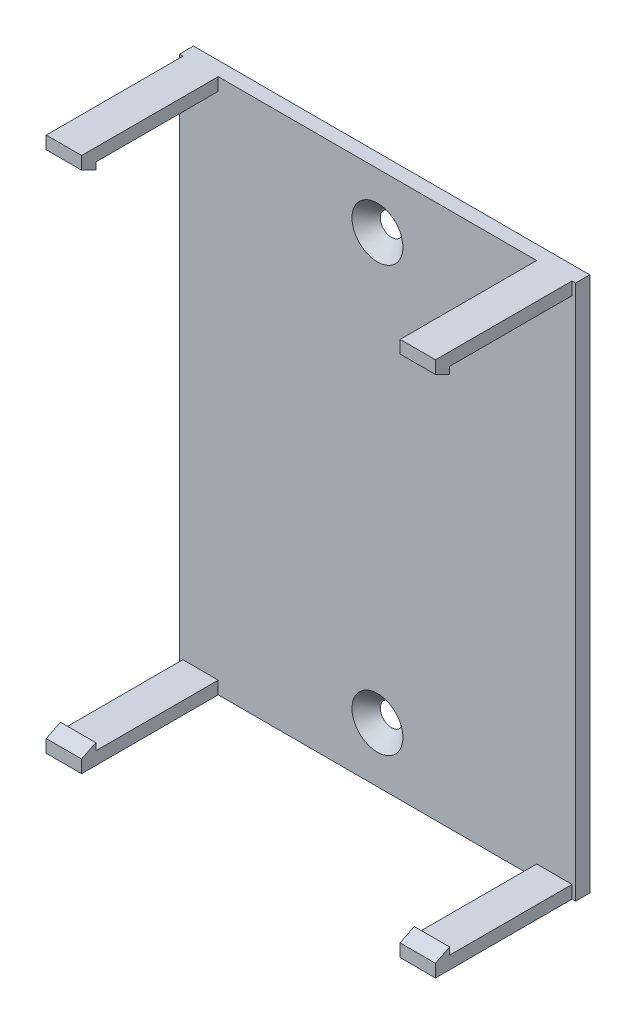
from build123d import *

# Parameters (mm, degrees)
SKETCH_1_W          = 56
SKETCH_1_H          = 75.65
EXTRUDE_1_DEPTH     = 2
SKETCH_2_W          = 5
SKETCH_2_H          = 1.8
EXTRUDE_2_DEPTH     = 19.3
EXTRUDE_3_DEPTH     = 5
EXTRUDE_4_DEPTH     = 5
EXTRUDE_5_DEPTH     = 5
EXTRUDE_6_DEPTH     = 5
SKETCH_7_R          = 1.6
CUT_EXTRUDE_1_DEPTH = 51.864728693
CHAMFER_1_SIZE      = 2


with BuildPart() as part:
    # 草图1 → 凸台-拉伸1 (new body)
    with BuildSketch(Plane.XY):
        Rectangle(SKETCH_1_W, SKETCH_1_H)
    extrude(amount=EXTRUDE_1_DEPTH)

    # 草图2 → 凸台-拉伸2 (add)
    with BuildSketch(Plane.XY.offset(2)):
        with Locations((-25, 36.925)):
            Rectangle(SKETCH_2_W, SKETCH_2_H)
        with Locations((25, 36.925)):
            Rectangle(SKETCH_2_W, SKETCH_2_H)
        with Locations((-25, -36.925)):
            Rectangle(SKETCH_2_W, SKETCH_2_H)
        with Locations((25, -36.925)):
            Rectangle(SKETCH_2_W, SKETCH_2_H)
    extrude(amount=EXTRUDE_2_DEPTH)

    # 草图3 → 凸台-拉伸3 (add)
    with BuildSketch(Plane.ZY.offset(27.5)):
        Polygon((21.3, 36.025), (19.3, 35.025), (19.3, 36.025), align=None)
    extrude(amount=-EXTRUDE_3_DEPTH)

    # 草图4 → 凸台-拉伸4 (add)
    with BuildSketch(Plane.ZY.offset(-22.5)):
        Polygon((19.3, 36.025), (19.3, 35.025), (21.3, 36.025), align=None)
    extrude(amount=-EXTRUDE_4_DEPTH)

    # 草图5 → 凸台-拉伸5 (add)
    with BuildSketch(Plane.ZY.offset(27.5)):
        Polygon((21.3, -36.025), (19.3, -35.025), (19.3, -36.025), align=None)
    extrude(amount=-EXTRUDE_5_DEPTH)

    # 草图6 → 凸台-拉伸6 (add)
    with BuildSketch(Plane.ZY.offset(-22.5)):
        Polygon((19.3, -36.025), (21.3, -36.025), (19.3, -35.025), align=None)
    extrude(amount=-EXTRUDE_6_DEPTH)

    # 草图7 → 切除-拉伸1 (cut, through all)
    with BuildSketch(Plane.XY.offset(2)):
        with Locations((0, 30)):
            Circle(SKETCH_7_R)
        with Locations((0, -30)):
            Circle(SKETCH_7_R)
    extrude(amount=-CUT_EXTRUDE_1_DEPTH, mode=Mode.SUBTRACT)

    # 倒角1
    chamfer_1_edges = [part.edges().sort_by_distance(p)[0] for p in [
        (-1.6, 30, 2),
        (-1.6, -30, 2),
    ]]
    chamfer(chamfer_1_edges, length=CHAMFER_1_SIZE - 0.0001)  # a hair under: the kernel refuses the full size


solid = part.part
